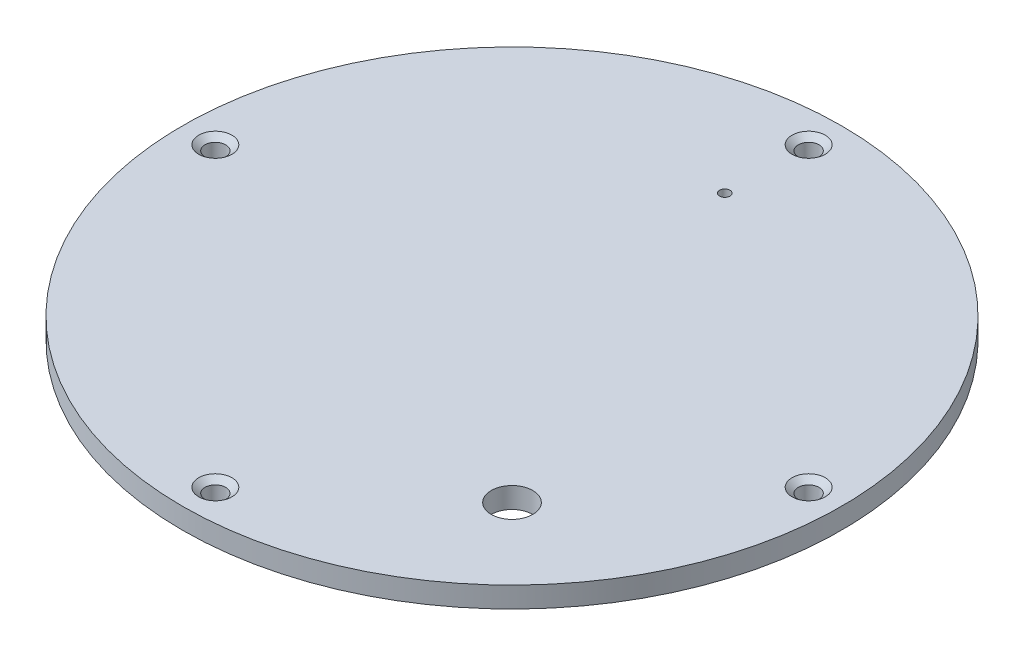
from build123d import *

# Parameters (mm, degrees)
SKETCH1_R                                       = 15.875
BOSS_EXTRUDE1_DEPTH                             = 1
CSK_FOR_M2_FLAT_HEAD_MACHINE_SCREW1_D           = 1
CSK_FOR_M2_FLAT_HEAD_MACHINE_SCREW1_CSINK_D     = 1.6
CSK_FOR_M2_FLAT_HEAD_MACHINE_SCREW1_CSINK_ANGLE = 100
CUT_EXTRUDE1_DEPTH                              = 23.472900347
CUT_EXTRUDE1_DEPTH_BACK                         = 23.472900347
SKETCH4_R                                       = 0.25
CUT_EXTRUDE2_DEPTH                              = 23.472900347
CUT_EXTRUDE2_DEPTH_BACK                         = 23.472900347
SKETCH5_R                                       = 1


with BuildPart() as part:
    # Sketch1 → Boss-Extrude1 (new body)
    with BuildSketch(Plane(origin=(0, 0, 0), x_dir=(1, 0, 0), z_dir=(0, 1, 0))):
        Circle(SKETCH1_R)
    extrude(amount=BOSS_EXTRUDE1_DEPTH)

    # CSK for M2 Flat Head Machine Screw1 (through all)
    with Locations(Plane(origin=(0, 1, 0), x_dir=(1, 0, 0), z_dir=(0, 1, 0))):
        with Locations((0, 14.29), (14.29, 0), (0, -14.29), (-14.29, 0)):
            CounterSinkHole(CSK_FOR_M2_FLAT_HEAD_MACHINE_SCREW1_D / 2, CSK_FOR_M2_FLAT_HEAD_MACHINE_SCREW1_CSINK_D / 2, counter_sink_angle=CSK_FOR_M2_FLAT_HEAD_MACHINE_SCREW1_CSINK_ANGLE)

    # Sketch4 → Cut-Extrude1 (cut, two sides: drawn at the far end of the back side and taken through both)
    with BuildSketch(Plane(origin=(0, 1, 0), x_dir=(1, 0, 0), z_dir=(0, 1, 0)).offset(-CUT_EXTRUDE1_DEPTH_BACK)):
        with Locations((0, 10.25)):
            Circle(SKETCH4_R)
    extrude(amount=CUT_EXTRUDE1_DEPTH + CUT_EXTRUDE1_DEPTH_BACK, mode=Mode.SUBTRACT)

    # Sketch5 → Cut-Extrude2 (cut, two sides: drawn at the far end of the back side and taken through both)
    with BuildSketch(Plane.XZ.offset(-CUT_EXTRUDE2_DEPTH_BACK)):
        with Locations((7.778174593, 7.778174593)):
            Circle(SKETCH5_R)
    extrude(amount=CUT_EXTRUDE2_DEPTH + CUT_EXTRUDE2_DEPTH_BACK, mode=Mode.SUBTRACT)


solid = part.part
